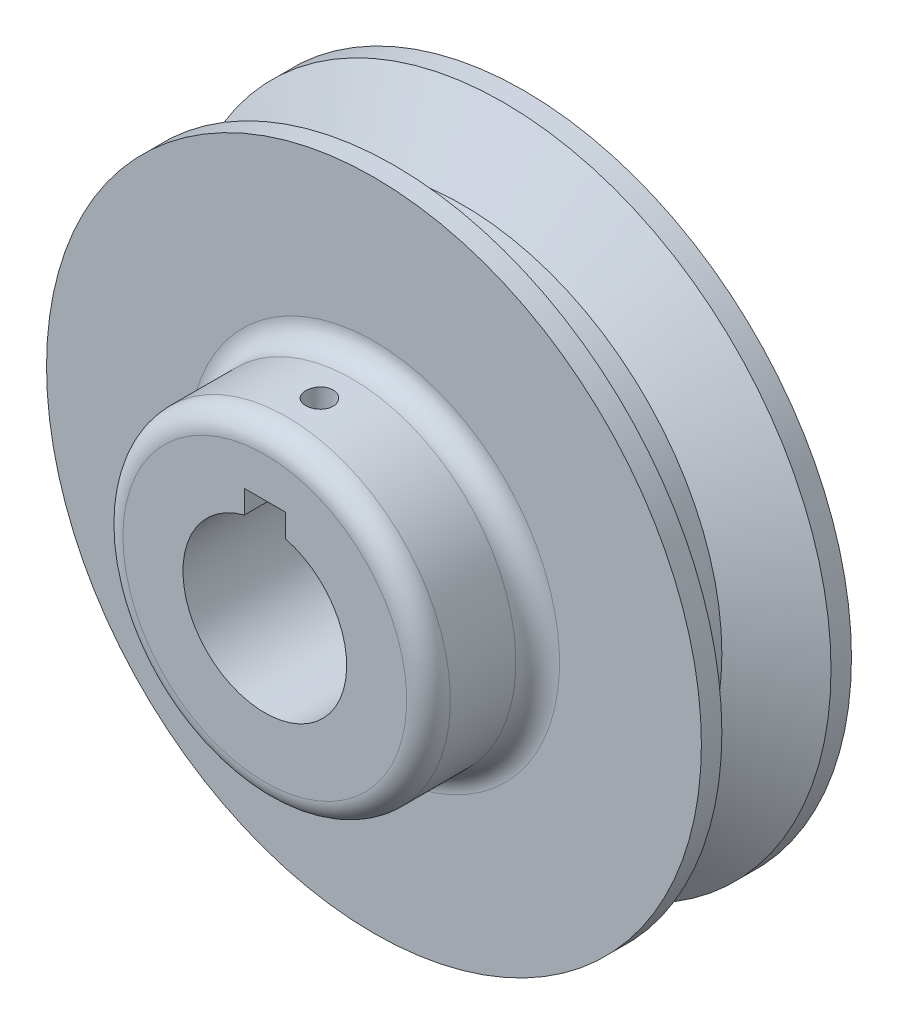
from build123d import *

# Parameters (mm, degrees)
SKETCH4_W          = 4.7625
SKETCH4_H          = 4.7625
CUT_EXTRUDE2_DEPTH = 62.749464826
SKETCH5_R          = 1.5875
CUT_EXTRUDE3_DEPTH = 62.749464826
FILLET1_R          = 2.54


with BuildPart() as part:
    # Sketch3 → Revolve2 (revolve)
    with BuildSketch(Plane(origin=(0, 0, 0), x_dir=(0, 0, -1), z_dir=(1, 0, 0))):
        Polygon((0, 9.525), (30.1625, 9.525), (30.1625, 38.1), (27.78125, 38.1), (23.01875, 30.1625), (19.84375, 30.1625), (15.08125, 38.1), (12.7, 38.1), (12.7, 19.05), (0, 19.05), align=None)
    revolve(axis=Axis((0, 0, 0), (0, 0, -1)))

    # Sketch4 → Cut-Extrude2 (cut, through all)
    with BuildSketch(Plane.XY):
        with Locations((0, 9.525)):
            Rectangle(SKETCH4_W, SKETCH4_H)
    extrude(amount=-CUT_EXTRUDE2_DEPTH, mode=Mode.SUBTRACT)

    # Sketch5 → Cut-Extrude3 (cut, through all)
    with BuildSketch(Plane(origin=(0, 0, 0), x_dir=(1, 0, 0), z_dir=(0, 1, 0))):
        with Locations((0, 6.35)):
            Circle(SKETCH5_R)
    extrude(amount=CUT_EXTRUDE3_DEPTH, mode=Mode.SUBTRACT)

    # Fillet1
    fillet1_edges = [part.edges().sort_by_distance(p)[0] for p in [
        (0, -19.05, -12.7),
        (0, -19.05, 0),
    ]]
    fillet(fillet1_edges, radius=FILLET1_R)


solid = part.part
